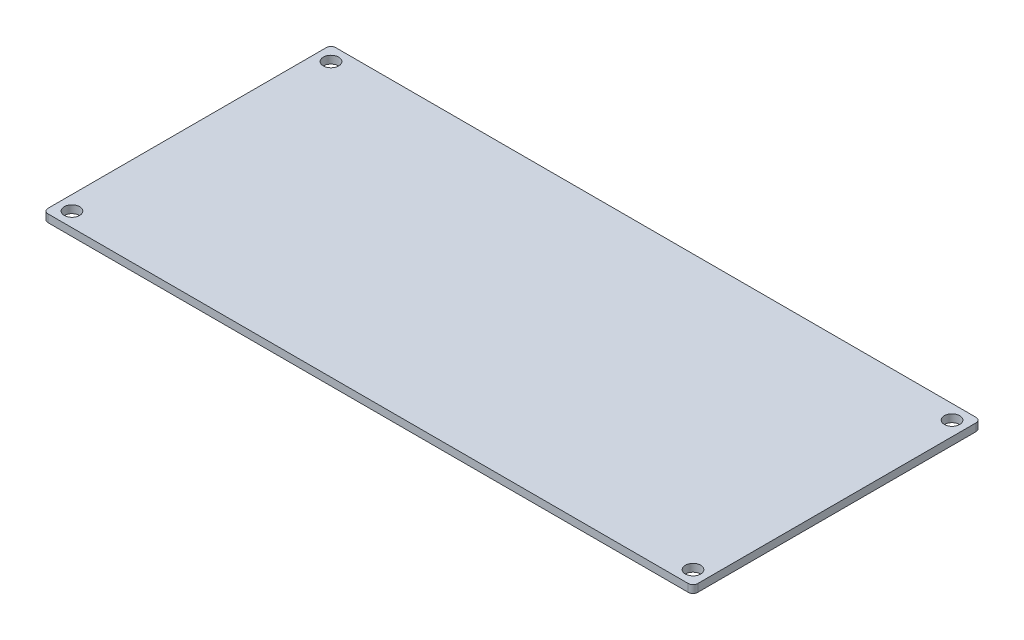
from build123d import *

# Parameters (mm, degrees)
SKETCH_1_W                 = 135.47
SKETCH_1_H                 = 60
EXTRUDE_1_DEPTH            = 1.6
HOLE_WIZARD_M3_1_OUTLINE_R = 1.6
HOLE_WIZARD_M3_1_DEPTH     = 1.6
FILLET_1_R                 = 1


# Read off the part's stored shape, not the designer's step: M3 すきま穴1
with BuildPart() as part:
    # ｽｹｯﾁ1 → ﾎﾞｽ - 押し出し1 (new body)
    with BuildSketch(Plane(origin=(0, 0, 0), x_dir=(1, 0, 0), z_dir=(0, 1, 0))):
        Rectangle(SKETCH_1_W, SKETCH_1_H)
    extrude(amount=EXTRUDE_1_DEPTH)

    # M3 すきま穴1 outline → M3 すきま穴1 (cut)
    with BuildSketch(Plane(origin=(0, 0, 0), x_dir=(1, 0, 0), z_dir=(0, 1, 0))):
        with Locations((64.735, 27)):
            Circle(HOLE_WIZARD_M3_1_OUTLINE_R)
        with Locations((-64.735, -27)):
            Circle(HOLE_WIZARD_M3_1_OUTLINE_R)
        with Locations((64.735, -27)):
            Circle(HOLE_WIZARD_M3_1_OUTLINE_R)
        with Locations((-64.735, 27)):
            Circle(HOLE_WIZARD_M3_1_OUTLINE_R)
    extrude(amount=HOLE_WIZARD_M3_1_DEPTH, mode=Mode.SUBTRACT)

    # ﾌｨﾚｯﾄ1
    fillet_1_edges = [part.edges().sort_by_distance(p)[0] for p in [
        (67.735, 0.8, 30),
        (-67.735, 0.8, 30),
        (-67.735, 0.8, -30),
        (67.735, 0.8, -30),
    ]]
    fillet(fillet_1_edges, radius=FILLET_1_R)


solid = part.part
